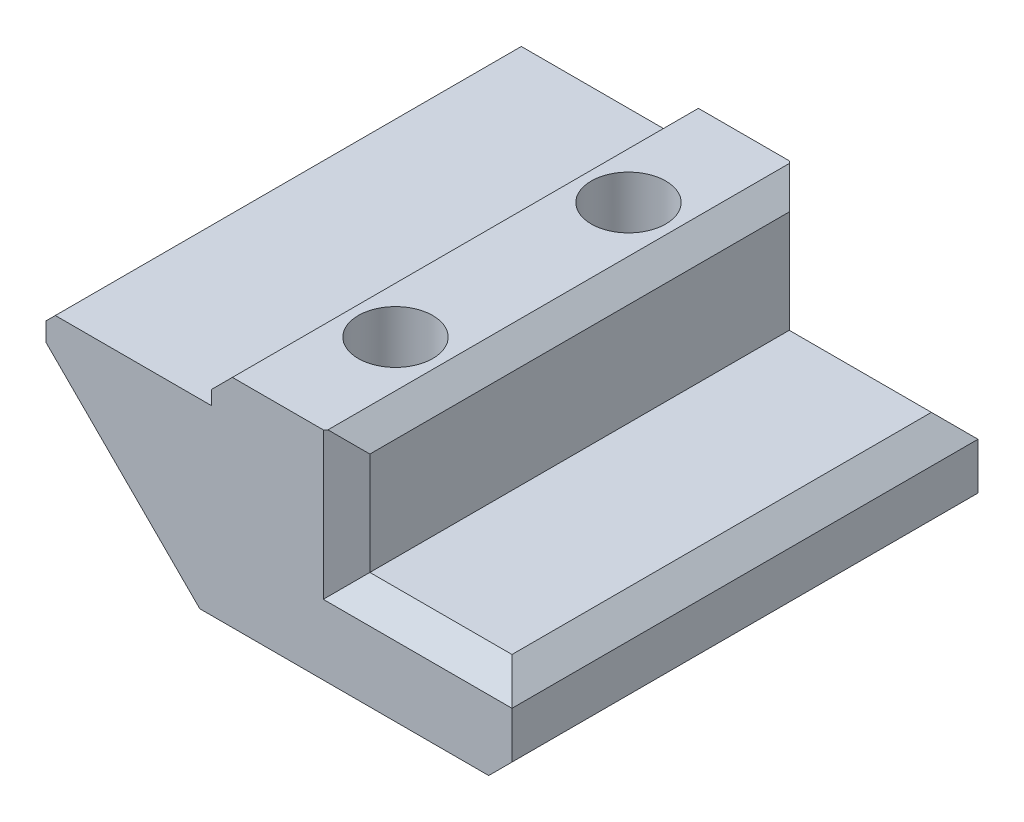
from build123d import *

# Parameters (mm, degrees)
SKETCH_1_W          = 20
SKETCH_1_H          = 20
EXTRUDE_1_DEPTH     = 4
SKETCH_2_W          = 12.9
SKETCH_2_H          = 20
EXTRUDE_2_DEPTH     = 3.8
SKETCH_3_R          = 1.6
CUT_EXTRUDE_1_DEPTH = 30.340074983
SKETCH_4_W          = 5.8
SKETCH_4_H          = 20
SKETCH_4_R          = 1.6
EXTRUDE_3_DEPTH     = 1.5
SKETCH_5_R          = 3
CUT_EXTRUDE_3_DEPTH = 2.4
CHAMFER_3_SIZE      = 1.5
CHAMFER_1_SIZE      = 6.6
CHAMFER_2_SIZE      = 1
CHAMFER_4_SIZE      = 0.4
CHAMFER_5_SIZE      = 0.9


with BuildPart() as part:
    # 草图1 → 凸台-拉伸1 (new body)
    with BuildSketch(Plane(origin=(0, 0, 0), x_dir=(1, 0, 0), z_dir=(0, 1, 0))):
        with Locations((10, 10)):
            Rectangle(SKETCH_1_W, SKETCH_1_H)
    extrude(amount=EXTRUDE_1_DEPTH)

    # 草图2 → 凸台-拉伸2 (add)
    with BuildSketch(Plane(origin=(0, 4, 0), x_dir=(1, 0, 0), z_dir=(0, 1, 0))):
        with Locations((6.45, 10)):
            Rectangle(SKETCH_2_W, SKETCH_2_H)
    extrude(amount=EXTRUDE_2_DEPTH)

    # 草图3 → 切除-拉伸1 (cut, through all)
    with BuildSketch(Plane(origin=(0, 0, 0), x_dir=(-1, 0, 0), z_dir=(0, -1, 0))):
        with Locations(Location((-10, 5, 0), (0, 0, 90))):
            Circle(SKETCH_3_R)
        with Locations(Location((-10, 15, 0), (0, 0, 90))):
            Circle(SKETCH_3_R)
    extrude(amount=-CUT_EXTRUDE_1_DEPTH, mode=Mode.SUBTRACT)

    # 草图4 → 凸台-拉伸3 (add)
    with BuildSketch(Plane(origin=(0, 7.8, 0), x_dir=(1, 0, 0), z_dir=(0, 1, 0))):
        with Locations((10, 10)):
            Rectangle(SKETCH_4_W, SKETCH_4_H)
        with Locations(Location((10, 15, 0), (0, 0, 90))):
            Circle(SKETCH_4_R, mode=Mode.SUBTRACT)
        with Locations(Location((10, 5, 0), (0, 0, 90))):
            Circle(SKETCH_4_R, mode=Mode.SUBTRACT)
    extrude(amount=EXTRUDE_3_DEPTH)

    # 草图5 → 切除-拉伸3 (cut)
    with BuildSketch(Plane(origin=(0, 0, 0), x_dir=(-1, 0, 0), z_dir=(0, -1, 0))):
        with Locations(Location((-10, 5, 0), (0, 0, 90))):
            Circle(SKETCH_5_R)
        with Locations(Location((-10, 15, 0), (0, 0, 90))):
            Circle(SKETCH_5_R)
    extrude(amount=-CUT_EXTRUDE_3_DEPTH, mode=Mode.SUBTRACT)

    # 倒角3
    # the kernel refuses this chamfer: 1.5 mm, written as the material it takes off along each edge
    with BuildSketch(Plane(origin=(10, 2.4, -15), x_dir=(0, 0, -1), z_dir=(-1, 0, 0))) as chamfer_3_piece_1_section:
        Polygon((1.6 + CHAMFER_3_SIZE, 0), (1.6, -CHAMFER_3_SIZE), (1.6, 0), align=None)
    chamfer_3_piece_1 = revolve(axis=Axis((10, 2.4, -15), (0, -1, 0)), mode=Mode.PRIVATE)
    chamfer_3_piece_1 = chamfer_3_piece_1 & Plane(origin=(10, 3.20338318, -15), x_dir=(0, 0, -1), z_dir=(0, -1, 0)) * Cylinder(3, 13, mode=Mode.PRIVATE)
    add(chamfer_3_piece_1, mode=Mode.SUBTRACT)
    with BuildSketch(Plane(origin=(10, 2.4, -5), x_dir=(0, 0, -1), z_dir=(-1, 0, 0))) as chamfer_3_piece_2_section:
        Polygon((1.6 + CHAMFER_3_SIZE, 0), (1.6, -CHAMFER_3_SIZE), (1.6, 0), align=None)
    chamfer_3_piece_2 = revolve(axis=Axis((10, 2.4, -5), (0, -1, 0)), mode=Mode.PRIVATE)
    chamfer_3_piece_2 = chamfer_3_piece_2 & Plane(origin=(10, 3.20338318, -5), x_dir=(0, 0, -1), z_dir=(0, -1, 0)) * Cylinder(3, 13, mode=Mode.PRIVATE)
    add(chamfer_3_piece_2, mode=Mode.SUBTRACT)

    # 倒角1
    chamfer_1_edges = [part.edges().sort_by_distance(p)[0] for p in [
        (0, 0, -10),
    ]]
    chamfer(chamfer_1_edges, length=CHAMFER_1_SIZE)

    # 倒角2
    chamfer_2_edges = [part.edges().sort_by_distance(p)[0] for p in [
        (20, 4, -10),
        (16.45, 4, 0),
        (12.9, 6.65, 0),
        (12.9, 6.65, -20),
        (16.45, 4, -20),
        (20, 0, -10),
    ]]
    chamfer(chamfer_2_edges, length=CHAMFER_2_SIZE)

    # 倒角4
    chamfer_4_edges = [part.edges().sort_by_distance(p)[0] for p in [
        (0, 7.8, -10),
    ]]
    chamfer(chamfer_4_edges, length=CHAMFER_4_SIZE)

    # 倒角5
    chamfer_5_edges = [part.edges().sort_by_distance(p)[0] for p in [
        (7.1, 9.3, -10),
        (12.9, 9.3, -10),
    ]]
    chamfer(chamfer_5_edges, length=CHAMFER_5_SIZE)


solid = part.part
